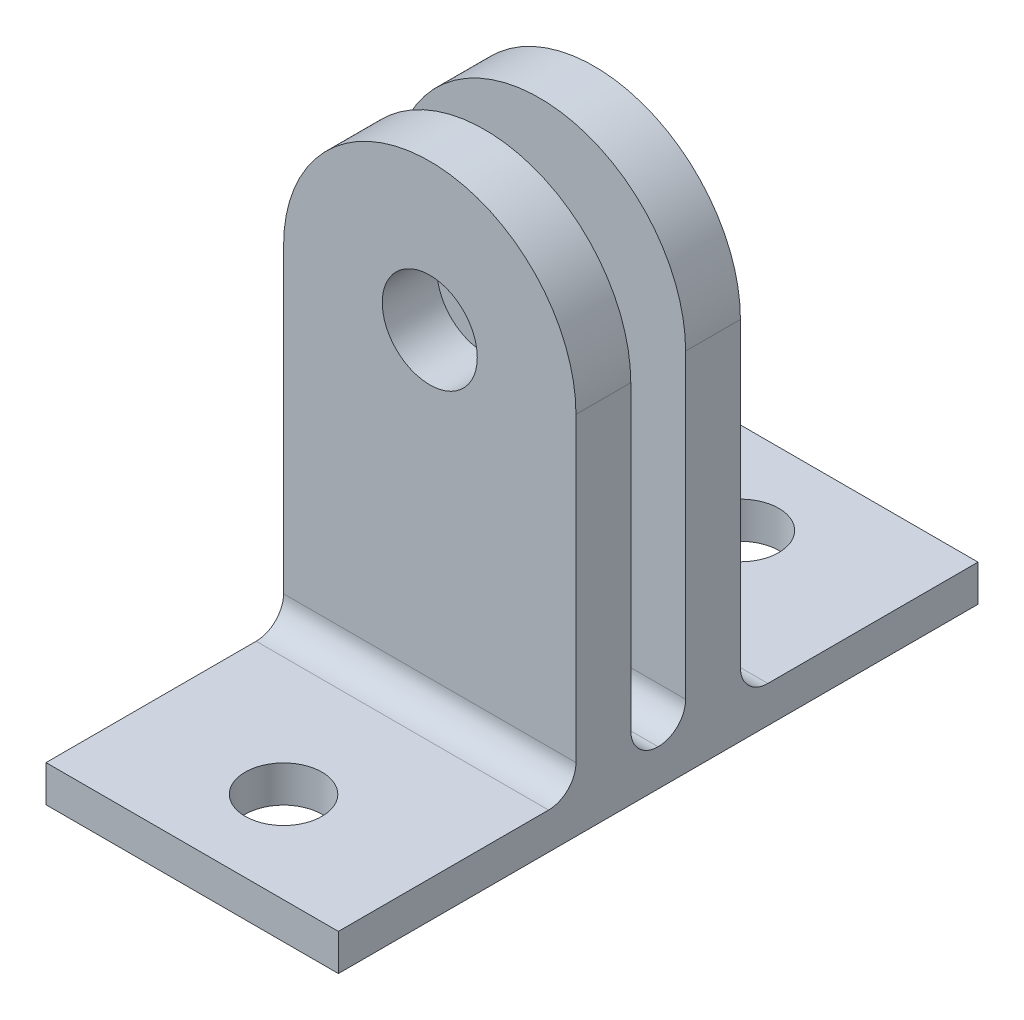
from build123d import *

# Parameters (mm, degrees)
SKETCH_2_W          = 16
SKETCH_2_H          = 35
EXTRUDE_1_DEPTH     = 2
EXTRUDE_START       = 1.5
SKETCH_4_R          = 2.6
EXTRUDE_2_DEPTH     = 3
FILLET_2_R          = 1.5
SKETCH_5_R          = 2.1
CUT_EXTRUDE_1_DEPTH = 33.345787979


with BuildPart() as part:
    # 草圖2 → 填料-伸長1 (new body)
    with BuildSketch(Plane(origin=(0, 0, 0), x_dir=(1, 0, 0), z_dir=(0, 1, 0))):
        Rectangle(SKETCH_2_W, SKETCH_2_H)
    extrude(amount=EXTRUDE_1_DEPTH)

    # 草圖4 → 填料-伸長2 (add)
    with BuildSketch(Plane.XY.offset(EXTRUDE_START)):
        with BuildLine():
            Line((8, 20), (8, 2))
            Line((8, 2), (-8, 2))
            Line((-8, 2), (-8, 20))
            ThreePointArc((-8, 20), (0, 28), (8, 20))
        make_face()
        with Locations((0, 20)):
            Circle(SKETCH_4_R, mode=Mode.SUBTRACT)
    extrude_2 = extrude(amount=EXTRUDE_2_DEPTH)

    # 鏡射1: 填料-伸長2 across plane
    add(extrude_2.mirror(Plane.XY))

    # 圓角2
    fillet_2_edges = [part.edges().sort_by_distance(p)[0] for p in [
        (0, 2, 4.5),
        (0, 2, 1.5),
        (0, 2, -4.5),
        (0, 2, -1.5),
    ]]
    fillet(fillet_2_edges, radius=FILLET_2_R - 0.0001)  # a hair under: the kernel refuses the full size

    # 草圖5 → 除料-伸長1 (cut, through all)
    with BuildSketch(Plane(origin=(0, 2, 0), x_dir=(1, 0, 0), z_dir=(0, 1, 0))):
        with Locations(Location((0, -12.5, 0), (0, 0, 270))):
            Circle(SKETCH_5_R)
        with Locations(Location((0, 12.5, 0), (0, 0, 90))):
            Circle(SKETCH_5_R)
    extrude(amount=-CUT_EXTRUDE_1_DEPTH, mode=Mode.SUBTRACT)


solid = part.part
